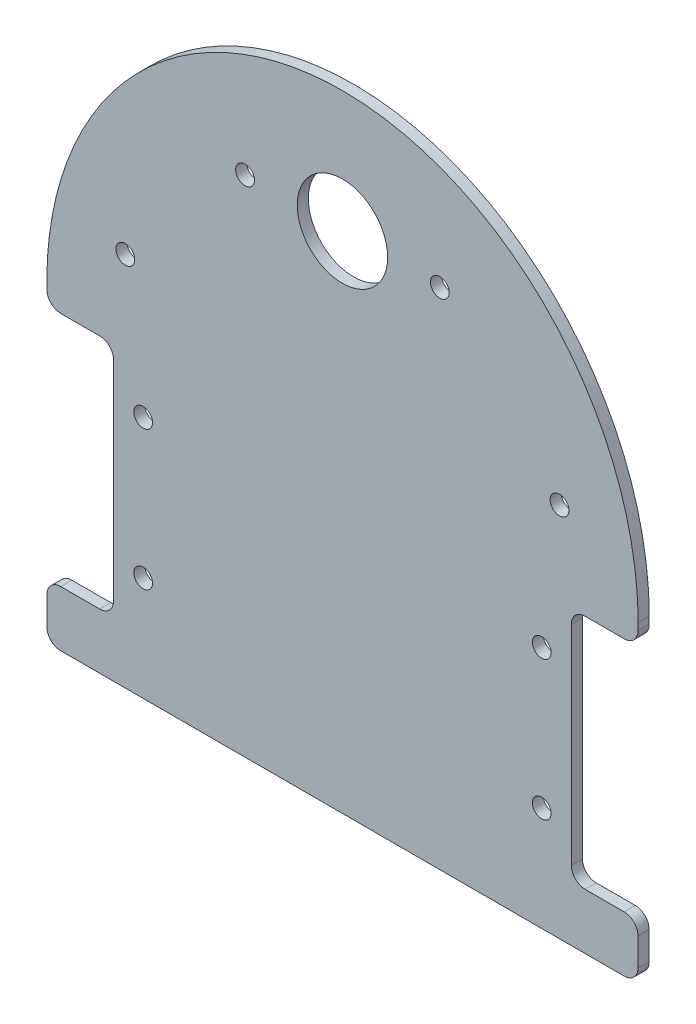
from build123d import *

# Parameters (mm, degrees)
SKETCH1_W           = 85
SKETCH1_H           = 90
BOSS_EXTRUDE1_DEPTH = 1.6
CUT_EXTRUDE1_DEPTH  = 62.917768048
SKETCH3_W           = 9.6
SKETCH3_H           = 34
CUT_EXTRUDE2_DEPTH  = 62.917768192
SKETCH4_R           = 6.5
CUT_EXTRUDE3_DEPTH  = 62.917768192
SKETCH5_R           = 1.35
CUT_EXTRUDE4_DEPTH  = 62.917768192
SKETCH6_R           = 1.35
CUT_EXTRUDE5_DEPTH  = 62.917768192
SKETCH7_R           = 1.35
CUT_EXTRUDE6_DEPTH  = 10
FILLET1_R           = 2


with BuildPart() as part:
    # Sketch1 → Boss-Extrude1 (new body)
    with BuildSketch(Plane.XY):
        Rectangle(SKETCH1_W, SKETCH1_H)
    extrude(amount=BOSS_EXTRUDE1_DEPTH)

    # Sketch2 → Cut-Extrude1 (cut, through all)
    with BuildSketch(Plane.XY.offset(1.6)):
        with BuildLine():
            Line((-42.5, 0), (-70, 0))
            Line((-70, 0), (-70, 70))
            Line((-70, 70), (70, 70))
            Line((70, 70), (70, 0))
            Line((70, 0), (42.5, 0))
            add(Edge.make_bspline(
                [(42.5, 0), (42.5, 45), (0, 45), (-42.5, 45), (-42.5, 0)],
                knots=[1.570796327, 1.570796327, 1.570796327, 3.141592654, 3.141592654, 4.71238898, 4.71238898, 4.71238898], degree=2, weights=[1, 0.707106781, 1, 0.707106781, 1]))
        make_face()
    extrude(amount=-CUT_EXTRUDE1_DEPTH, mode=Mode.SUBTRACT)

    # Sketch3 → Cut-Extrude2 (cut, through all)
    with BuildSketch(Plane.XY.offset(1.6)):
        with Locations((-37.7, -20)):
            Rectangle(SKETCH3_W, SKETCH3_H)
        with Locations((37.7, -20)):
            Rectangle(SKETCH3_W, SKETCH3_H)
    extrude(amount=-CUT_EXTRUDE2_DEPTH, mode=Mode.SUBTRACT)

    # Sketch4 → Cut-Extrude3 (cut, through all)
    with BuildSketch(Plane.XY.offset(1.6)):
        with Locations((0, 27.5)):
            Circle(SKETCH4_R)
    extrude(amount=-CUT_EXTRUDE3_DEPTH, mode=Mode.SUBTRACT)

    # Sketch5 → Cut-Extrude4 (cut, through all)
    with BuildSketch(Plane.XY.offset(1.6)):
        with Locations((-28.65, -10)):
            Circle(SKETCH5_R)
        with Locations((-28.65, -30)):
            Circle(SKETCH5_R)
        with Locations((28.65, -30)):
            Circle(SKETCH5_R)
        with Locations((28.65, -10)):
            Circle(SKETCH5_R)
    extrude(amount=-CUT_EXTRUDE4_DEPTH, mode=Mode.SUBTRACT)

    # Sketch6 → Cut-Extrude5 (cut, through all)
    with BuildSketch(Plane.XY.offset(1.6)):
        with Locations((-14, 27.5)):
            Circle(SKETCH6_R)
        with Locations((14, 27.5)):
            Circle(SKETCH6_R)
    extrude(amount=-CUT_EXTRUDE5_DEPTH, mode=Mode.SUBTRACT)

    # Sketch7 → Cut-Extrude6 (cut)
    with BuildSketch(Plane.XY.offset(1.6)):
        with Locations((-31.2085, 9)):
            Circle(SKETCH7_R)
        with Locations((31.2085, 9)):
            Circle(SKETCH7_R)
    extrude(amount=-CUT_EXTRUDE6_DEPTH, mode=Mode.SUBTRACT)

    # Fillet1
    fillet1_edges = [part.edges().sort_by_distance(p)[0] for p in [
        (42.5, -37, 0.8),
        (32.9, -37, 0.8),
        (32.9, -3, 0.8),
        (42.5, -3, 0.8),
        (-32.9, -37, 0.8),
        (-32.9, -3, 0.8),
        (-42.5, -37, 0.8),
        (-42.5, -3, 0.8),
        (42.5, -45, 0.8),
        (-42.5, -45, 0.8),
    ]]
    fillet(fillet1_edges, radius=FILLET1_R)


solid = part.part
